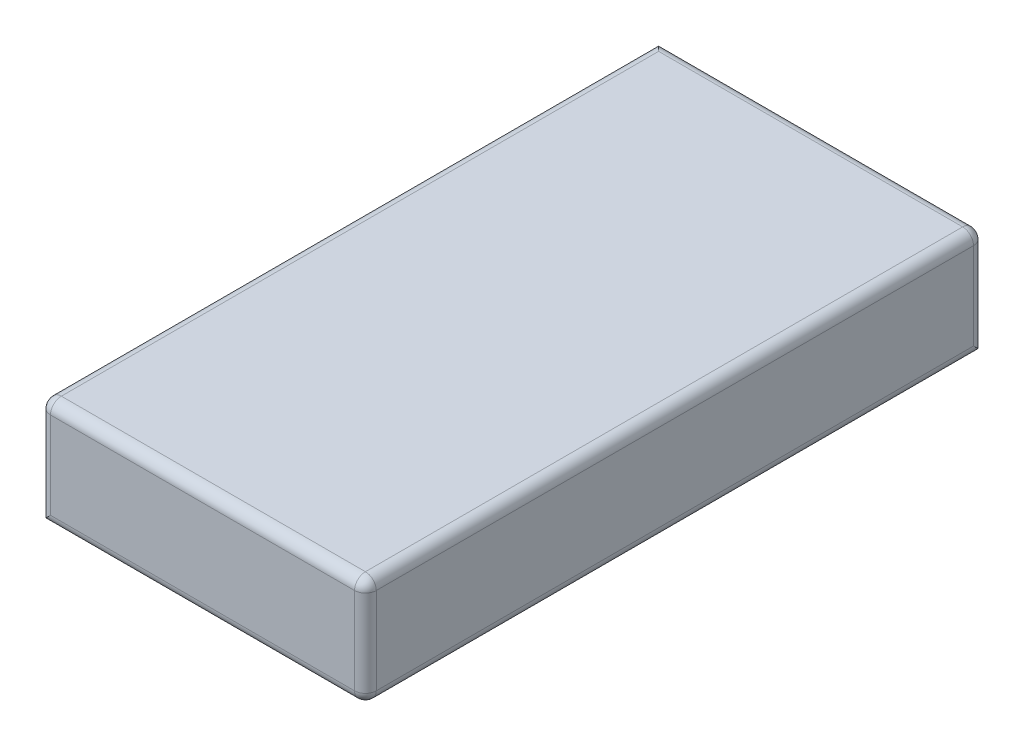
from build123d import *

# Parameters (mm, degrees)
SKETCH1_W           = 30
SKETCH1_H           = 10
BOSS_EXTRUDE1_DEPTH = 57
FILLET1_R           = 1


with BuildPart() as part:
    # Sketch1 → Boss-Extrude1 (new body)
    with BuildSketch(Plane.XY):
        Rectangle(SKETCH1_W, SKETCH1_H)
    extrude(amount=BOSS_EXTRUDE1_DEPTH)

    # Fillet1
    fillet1_edges = [part.edges().sort_by_distance(p)[0] for p in [
        (15, 0, 0),
        (0, 5, 0),
        (15, 0, 57),
        (0, 5, 57),
        (-15, 0, 57),
        (0, -5, 57),
        (15, -5, 28.5),
        (-15, 5, 28.5),
        (15, 5, 28.5),
    ]]
    fillet(fillet1_edges, radius=FILLET1_R)


solid = part.part
